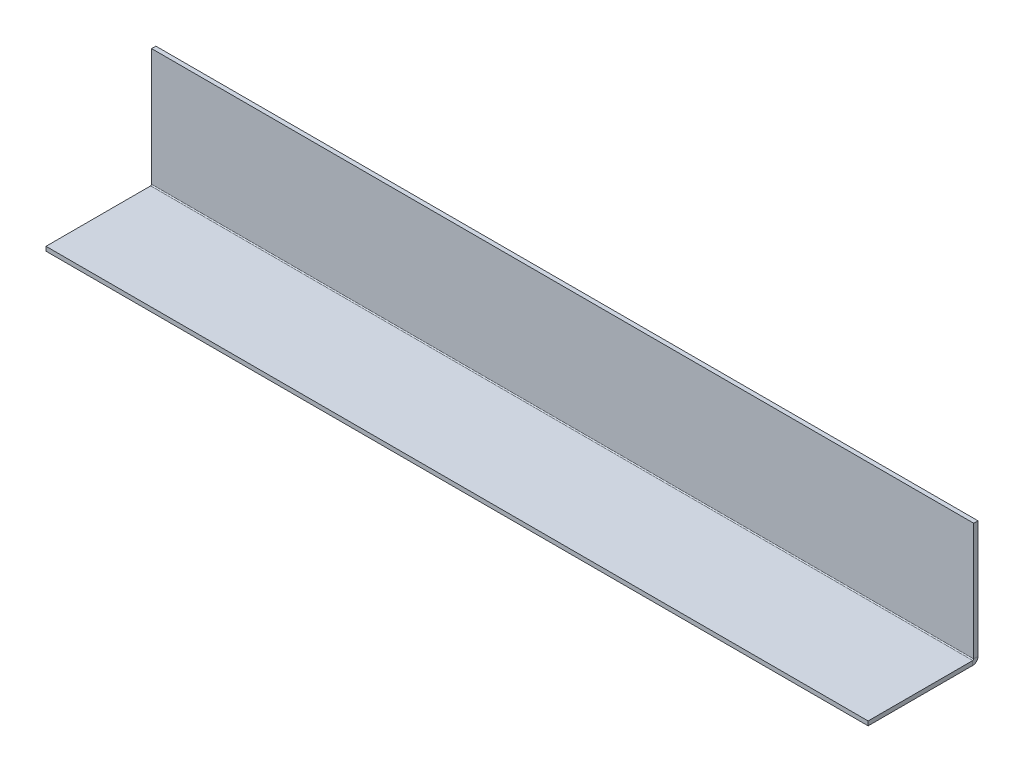
from build123d import *

# Parameters (mm, degrees)
SKETCH8_W              = 609.6
SKETCH8_H              = 174.625
BASE_FLANGE4_DEPTH     = 3.175
SKETCHED_START         = -304.8
SKETCHED_BEND4_DEPTH   = 609.6
SKETCHED_BEND4_2_DEPTH = 609.6
SKETCH24_W             = 609.6
SKETCH24_H             = 6.35
CUT_EXTRUDE1_DEPTH     = 328.356760899


# Read off the part's stored shape, not the designer's step: Sketched Bend4
# Sheet-metal steps are written as plain solids
with BuildPart() as part:
    # Sketch8 → Base-Flange4 (new body)
    with BuildSketch(Plane.XY):
        Rectangle(SKETCH8_W, SKETCH8_H)
    extrude(amount=-BASE_FLANGE4_DEPTH)

    # Sketched Bend4 outline → Sketched Bend4 (cut)
    with BuildSketch(Plane.YZ.offset(SKETCHED_START)):
        with BuildLine():
            ThreePointArc((-6.112156128, -3.175), (-8.604076071, -2.278520157), (-9.953774928, 0))
            Line((-9.953774928, 0), (-87.3125, 0))
            Line((-87.3125, 0), (-87.3125, -3.175))
            Line((-87.3125, -3.175), (-6.112156128, -3.175))
        make_face()
    extrude(amount=SKETCHED_BEND4_DEPTH, mode=Mode.SUBTRACT)

    # Sketched Bend4 2 outline → Sketched Bend4 2 (add)
    with BuildSketch(Plane.YZ.offset(SKETCHED_START)):
        with BuildLine():
            Line((-6.848756128, 78.286256128), (-10.023756128, 78.286256128))
            Line((-10.023756128, 78.286256128), (-10.023756128, 0.7366))
            ThreePointArc((-10.023756128, 0.7366), (-10.006221527, 0.366641581), (-9.953774928, 0))
            Line((-9.953774928, 0), (-6.112156128, 0))
            ThreePointArc((-6.112156128, 0), (-6.633010983, 0.215745145), (-6.848756128, 0.7366))
            Line((-6.848756128, 0.7366), (-6.848756128, 78.286256128))
        make_face()
    extrude(amount=SKETCHED_BEND4_2_DEPTH)

    # Sketch24 → Cut-Extrude1 (cut, through all)
    with BuildSketch(Plane(origin=(0, 0, -3.175), x_dir=(-1, 0, 0), z_dir=(0, 0, -1))):
        with Locations((0, 84.1375)):
            Rectangle(SKETCH24_W, SKETCH24_H)
    extrude(amount=-CUT_EXTRUDE1_DEPTH, mode=Mode.SUBTRACT)


solid = part.part
